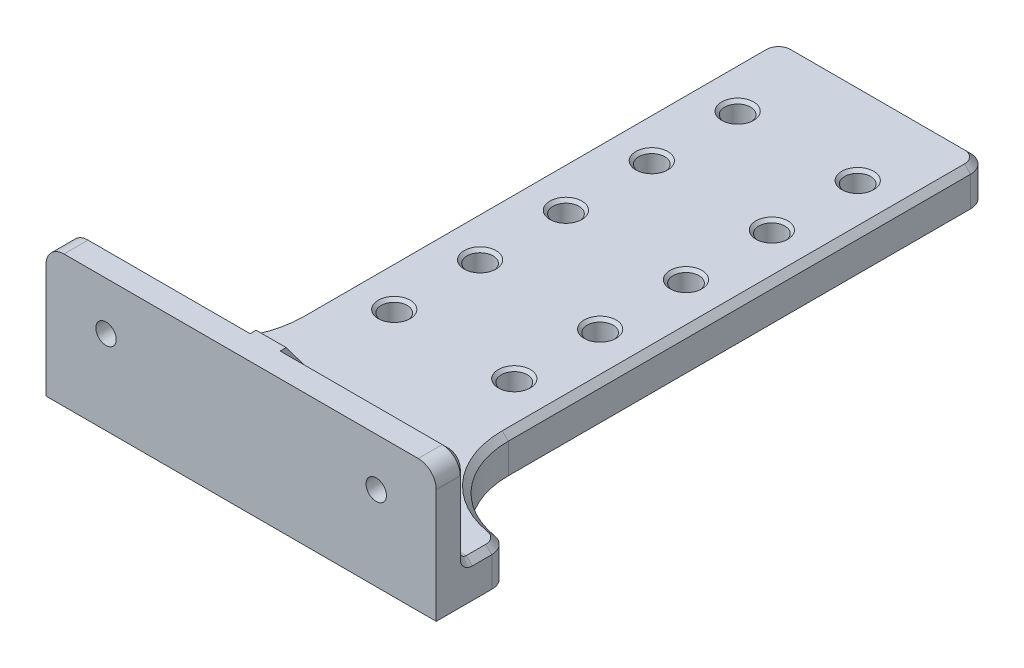
from build123d import *

# Parameters (mm, degrees)
SKETCH1_W                                       = 5
SKETCH1_H                                       = 22
BOSS_EXTRUDE1_DEPTH                             = 65
SKETCH2_W                                       = 17.5
SKETCH2_H                                       = 95
SKETCH2_H_2                                     = 7
SKETCH2_W_2                                     = 15
BOSS_EXTRUDE2_DEPTH                             = 6
CSK_FOR_M3_FLAT_HEAD_MACHINE_SCREW1_D           = 3.4
CSK_FOR_M3_FLAT_HEAD_MACHINE_SCREW1_CSINK_D     = 6.3
CSK_FOR_M3_FLAT_HEAD_MACHINE_SCREW1_CSINK_ANGLE = 90
M3_CLEARANCE_HOLE2_AT_2_COUNT                   = 2
M3_CLEARANCE_HOLE2_AT_2_PITCH                   = 20
M3_CLEARANCE_HOLE2_AT_3_COUNT                   = 2
M3_CLEARANCE_HOLE2_AT_3_PITCH                   = 24.586378342
M3_CLEARANCE_HOLE2_AT_4_COUNT                   = 2
M3_CLEARANCE_HOLE2_AT_4_PITCH                   = 14.3
M3_CLEARANCE_HOLE2_AT_5_COUNT                   = 2
M3_CLEARANCE_HOLE2_AT_5_PITCH                   = 28.6
M3_CLEARANCE_HOLE2_AT_6_COUNT                   = 2
M3_CLEARANCE_HOLE2_AT_6_PITCH                   = 34.89928366
M3_CLEARANCE_HOLE2_AT_7_COUNT                   = 2
M3_CLEARANCE_HOLE2_AT_7_PITCH                   = 47.332969482
M3_CLEARANCE_HOLE2_AT_8_COUNT                   = 2
M3_CLEARANCE_HOLE2_AT_8_PITCH                   = 42.9
M3_CLEARANCE_HOLE2_AT_9_COUNT                   = 2
M3_CLEARANCE_HOLE2_AT_9_PITCH                   = 57.2
M3_CLEARANCE_HOLE2_AT_10_COUNT                  = 2
M3_CLEARANCE_HOLE2_AT_10_PITCH                  = 60.595709419
SKETCH8_R                                       = 2.165
CUT_EXTRUDE1_DEPTH                              = 5
RIB5_REACH                                      = 111.29
SKETCH9_WALL_W                                  = 240.579504986
SKETCH9_WALL_H                                  = 5
FILLET1_R                                       = 15
FILLET2_R                                       = 3
FILLET6_R                                       = 1
CHAMFER1_SIZE                                   = 1
CHAMFER2_SIZE                                   = 0.5


with BuildPart() as part:
    # Sketch1 → Boss-Extrude1 (new body)
    with BuildSketch(Plane(origin=(0, 0, 0), x_dir=(0, 0, -1), z_dir=(1, 0, 0))):
        with Locations((-2.5, 11)):
            Rectangle(SKETCH1_W, SKETCH1_H)
    extrude(amount=BOSS_EXTRUDE1_DEPTH)

    # Sketch2 → Boss-Extrude2 (add)
    with BuildSketch(Plane(origin=(0, 0, 0), x_dir=(1, 0, 0), z_dir=(0, 1, 0))):
        with Locations((23.75, 54.5)):
            Rectangle(SKETCH2_W, SKETCH2_H)
        with Locations((41.25, 54.5)):
            Rectangle(SKETCH2_W, SKETCH2_H)
        with Locations((41.25, 3.5)):
            Rectangle(SKETCH2_W, SKETCH2_H_2)
        with Locations((23.75, 3.5)):
            Rectangle(SKETCH2_W, SKETCH2_H_2)
        with Locations((7.5, 3.5)):
            Rectangle(SKETCH2_W_2, SKETCH2_H_2)
        with Locations((57.5, 3.5)):
            Rectangle(SKETCH2_W_2, SKETCH2_H_2)
    extrude(amount=BOSS_EXTRUDE2_DEPTH)

    # CSK for M3 Flat Head Machine Screw1 (through all)
    with Locations(Plane(origin=(0, 0, 0), x_dir=(-1, 0, 0), z_dir=(0, 0, -1))):
        with Locations((-55, 14), (-10, 14)):
            CounterSinkHole(CSK_FOR_M3_FLAT_HEAD_MACHINE_SCREW1_D / 2, CSK_FOR_M3_FLAT_HEAD_MACHINE_SCREW1_CSINK_D / 2, counter_sink_angle=CSK_FOR_M3_FLAT_HEAD_MACHINE_SCREW1_CSINK_ANGLE)

    # Sketch7 → M3 Clearance Hole2 (revolve, cut)
    with BuildSketch(Plane(origin=(22.5, 6, -30.5), x_dir=(0, 0, 1), z_dir=(1, 0, 0))):
        Polygon((0, 0), (0, 6), (2.2, 6), (1.7, 5.5), (1.7, 0), align=None)
    m3_clearance_hole2 = revolve(axis=Axis((22.5, 12.35, -30.5), (0, -1, 0)), mode=Mode.SUBTRACT)

    # M3 Clearance Hole2 at 2: M3 Clearance Hole2 ×2
    with Locations(*[(i * M3_CLEARANCE_HOLE2_AT_2_PITCH, 0, 0) for i in range(1, M3_CLEARANCE_HOLE2_AT_2_COUNT)]):
        add(m3_clearance_hole2, mode=Mode.SUBTRACT)

    # M3 Clearance Hole2 at 3: M3 Clearance Hole2 ×2
    with Locations(*[Vector(0.8134585631685806, 0, -0.5816228726655346) * (i * M3_CLEARANCE_HOLE2_AT_3_PITCH) for i in range(1, M3_CLEARANCE_HOLE2_AT_3_COUNT)]):
        add(m3_clearance_hole2, mode=Mode.SUBTRACT)

    # M3 Clearance Hole2 at 4: M3 Clearance Hole2 ×2
    with Locations(*[(0, 0, -i * M3_CLEARANCE_HOLE2_AT_4_PITCH) for i in range(1, M3_CLEARANCE_HOLE2_AT_4_COUNT)]):
        add(m3_clearance_hole2, mode=Mode.SUBTRACT)

    # M3 Clearance Hole2 at 5: M3 Clearance Hole2 ×2
    with Locations(*[(0, 0, -i * M3_CLEARANCE_HOLE2_AT_5_PITCH) for i in range(1, M3_CLEARANCE_HOLE2_AT_5_COUNT)]):
        add(m3_clearance_hole2, mode=Mode.SUBTRACT)

    # M3 Clearance Hole2 at 6: M3 Clearance Hole2 ×2
    with Locations(*[Vector(0.5730776652808003, 0, -0.8195010613515441) * (i * M3_CLEARANCE_HOLE2_AT_6_PITCH) for i in range(1, M3_CLEARANCE_HOLE2_AT_6_COUNT)]):
        add(m3_clearance_hole2, mode=Mode.SUBTRACT)

    # M3 Clearance Hole2 at 7: M3 Clearance Hole2 ×2
    with Locations(*[Vector(0.4225384593192284, 0, -0.9063449952397448) * (i * M3_CLEARANCE_HOLE2_AT_7_PITCH) for i in range(1, M3_CLEARANCE_HOLE2_AT_7_COUNT)]):
        add(m3_clearance_hole2, mode=Mode.SUBTRACT)

    # M3 Clearance Hole2 at 8: M3 Clearance Hole2 ×2
    with Locations(*[(0, 0, -i * M3_CLEARANCE_HOLE2_AT_8_PITCH) for i in range(1, M3_CLEARANCE_HOLE2_AT_8_COUNT)]):
        add(m3_clearance_hole2, mode=Mode.SUBTRACT)

    # M3 Clearance Hole2 at 9: M3 Clearance Hole2 ×2
    with Locations(*[(0, 0, -i * M3_CLEARANCE_HOLE2_AT_9_PITCH) for i in range(1, M3_CLEARANCE_HOLE2_AT_9_COUNT)]):
        add(m3_clearance_hole2, mode=Mode.SUBTRACT)

    # M3 Clearance Hole2 at 10: M3 Clearance Hole2 ×2
    with Locations(*[Vector(0.3300563718411858, 0, -0.943961223465791) * (i * M3_CLEARANCE_HOLE2_AT_10_PITCH) for i in range(1, M3_CLEARANCE_HOLE2_AT_10_COUNT)]):
        add(m3_clearance_hole2, mode=Mode.SUBTRACT)

    # Sketch8 → Cut-Extrude1 (cut)
    with BuildSketch(Plane(origin=(0, 6, 0), x_dir=(1, 0, 0), z_dir=(0, 1, 0))):
        with Locations(Location((22.5, 87.7, 0), (0, 0, 270))):
            Circle(SKETCH8_R)
        with Locations(Location((42.5, 87.7, 0), (0, 0, 270))):
            Circle(SKETCH8_R)
        with Locations(Location((22.5, 73.4, 0), (0, 0, 270))):
            Circle(SKETCH8_R)
        with Locations(Location((42.5, 73.4, 0), (0, 0, 270))):
            Circle(SKETCH8_R)
        with Locations(Location((22.5, 59.1, 0), (0, 0, 270))):
            Circle(SKETCH8_R)
        with Locations(Location((42.5, 59.1, 0), (0, 0, 270))):
            Circle(SKETCH8_R)
        with Locations(Location((22.5, 44.8, 0), (0, 0, 270))):
            Circle(SKETCH8_R)
        with Locations(Location((42.5, 44.8, 0), (0, 0, 270))):
            Circle(SKETCH8_R)
        with Locations(Location((22.5, 30.5, 0), (0, 0, 270))):
            Circle(SKETCH8_R)
        with Locations(Location((42.5, 30.5, 0), (0, 0, 270))):
            Circle(SKETCH8_R)
    extrude(amount=-CUT_EXTRUDE1_DEPTH, mode=Mode.SUBTRACT)

    # Sketch9 wall → Rib5 (add, up to next)
    with BuildSketch(Plane(origin=(32.5, 14, -6), x_dir=(0, -0.8, -0.6), z_dir=(0, 0.6, -0.8)), mode=Mode.PRIVATE) as rib5_sk1:
        Rectangle(SKETCH9_WALL_W, SKETCH9_WALL_H)
    rib5_tool1 = extrude(rib5_sk1.sketch, amount=-RIB5_REACH, mode=Mode.PRIVATE) - part.part
    add(rib5_tool1.solids().sort_by_distance((32.5, 14, -6))[0])

    # Fillet1
    fillet1_edges = [part.edges().sort_by_distance(p)[0] for p in [
        (50, 3, -7),
        (15, 3, -7),
    ]]
    fillet(fillet1_edges, radius=FILLET1_R - 0.0001)  # a hair under: the kernel refuses the full size

    # Fillet2
    fillet2_edges = [part.edges().sort_by_distance(p)[0] for p in [
        (65, 3, -7),
        (50, 3, -102),
        (15, 3, -102),
        (0, 3, -7),
        (0, 22, 2.5),
        (65, 22, 2.5),
    ]]
    fillet(fillet2_edges, radius=FILLET2_R)

    # Fillet6
    fillet6_edges = [part.edges().sort_by_distance(p)[0] for p in [
        (50, 6, 0),
        (15, 6, 0),
        (30, 6, -6),
        (32.5, 6, -12),
        (35, 6, -6),
    ]]
    fillet(fillet6_edges, radius=FILLET6_R)

    # Chamfer1
    chamfer1_edges = [part.edges().sort_by_distance(p)[0] for p in [
        (16.5, 22, 0),
        (50, 6, -60.49995),
        (15, 6, -60.49995),
        (11.45644013, 6, -12.317479289),
        (53.54355987, 6, -12.317479289),
        (32.5, 6, -102),
        (15.878679656, 6, -101.121320344),
        (49.121320344, 6, -101.121320344),
        (64.291283301, 6, -6.188242219),
        (0.708716699, 6, -6.188242219),
        (48.5, 22, 0),
        (64.121320344, 21.121320344, 0),
        (0.878679656, 21.121320344, 0),
        (0, 13, 0),
        (0, 6, -2.625872583),
        (65, 6, -2.625872583),
        (65, 13, 0),
        (0, 6.292893219, -0.292893219),
        (65, 6.292893219, -0.292893219),
    ]]
    chamfer(chamfer1_edges, length=CHAMFER1_SIZE)

    # Chamfer2
    chamfer2_edges = [part.edges().sort_by_distance(p)[0] for p in [
        (42.5, 6, -61.265),
        (22.5, 6, -46.965),
        (42.5, 6, -46.965),
        (22.5, 6, -32.665),
        (42.5, 6, -89.865),
        (22.5, 6, -75.565),
        (42.5, 6, -75.565),
        (22.5, 6, -61.265),
        (42.5, 6, -32.665),
        (22.5, 6, -89.865),
    ]]
    chamfer(chamfer2_edges, length=CHAMFER2_SIZE)


solid = part.part
